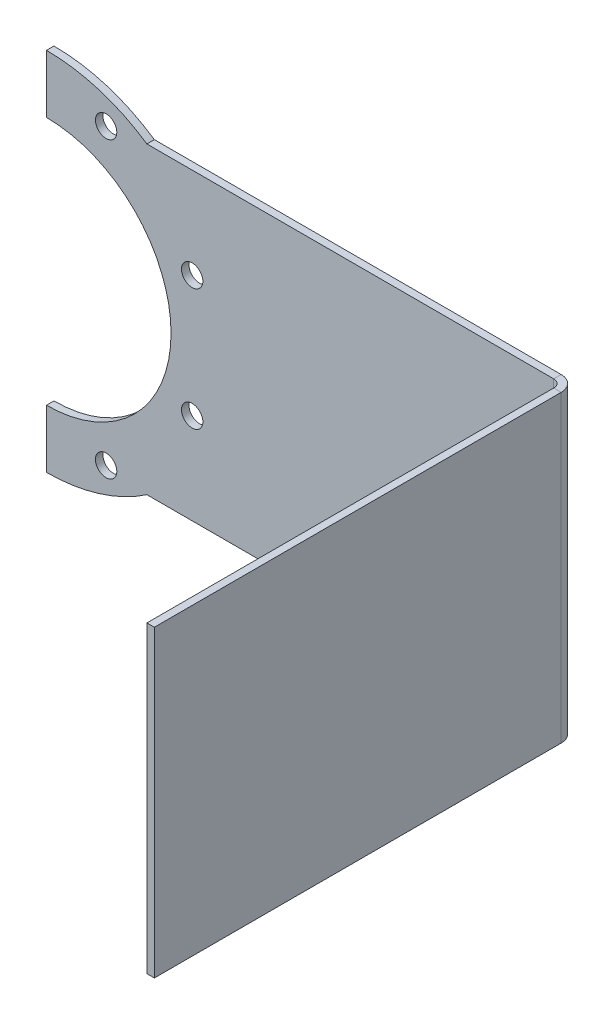
from build123d import *

# Parameters (mm, degrees)
SKETCH1_R              = 2.25
BASE_FLANGE1_DEPTH     = 1.5748
SKETCHED_START         = -31.998080115
SKETCHED_BEND1_DEPTH   = 63.99616023
SKETCHED_BEND1_2_DEPTH = 63.99616023


# Read off the part's stored shape, not the designer's step: Sketched Bend1
# Sheet-metal steps are written as plain solids
with BuildPart() as part:
    # Sketch1 → Base-Flange1 (new body)
    with BuildSketch(Plane.XY):
        with BuildLine():
            Line((0.25, 38.499188303), (0.25, 26.248809497))
            ThreePointArc((0.25, 26.248809497), (26.498809497, 0), (0.25, -26.248809497))
            Line((0.25, -26.248809497), (0.25, -38.499188303))
            ThreePointArc((0.25, -38.499188303), (11.317914827, -36.837266048), (21.409644298, -31.998080115))
            Line((21.409644298, -31.998080115), (102.929679939, -31.998080115))
            Line((102.929679939, -31.998080115), (196.443018387, -31.998080115))
            Line((196.443018387, -31.998080115), (196.443018387, 31.998080115))
            Line((196.443018387, 31.998080115), (102.929679939, 31.998080115))
            Line((102.929679939, 31.998080115), (21.409644298, 31.998080115))
            ThreePointArc((21.409644298, 31.998080115), (11.317914827, 36.837266048), (0.25, 38.499188303))
        make_face()
        with Locations((12.819894984, 30.949964339)):
            Circle(SKETCH1_R, mode=Mode.SUBTRACT)
        with Locations((30.949964339, 12.819894984)):
            Circle(SKETCH1_R, mode=Mode.SUBTRACT)
        with Locations((30.949964339, -12.819894984)):
            Circle(SKETCH1_R, mode=Mode.SUBTRACT)
        with Locations((12.819894984, -30.949964339)):
            Circle(SKETCH1_R, mode=Mode.SUBTRACT)
    extrude(amount=-BASE_FLANGE1_DEPTH)

    # Sketched Bend1 outline → Sketched Bend1 (cut)
    with BuildSketch(Plane(origin=(0, 0, 0), x_dir=(1, 0, 0), z_dir=(0, 1, 0)).offset(SKETCHED_START)):
        with BuildLine():
            ThreePointArc((107.11495185, 1.5748), (108.71495025, 1.153848498), (109.90062672, 0))
            Line((109.90062672, 0), (196.443018387, 0))
            Line((196.443018387, 0), (196.443018387, 1.5748))
            Line((196.443018387, 1.5748), (107.11495185, 1.5748))
        make_face()
    extrude(amount=SKETCHED_BEND1_DEPTH, mode=Mode.SUBTRACT)

    # Sketched Bend1 2 outline → Sketched Bend1 2 (add)
    with BuildSketch(Plane(origin=(0, 0, 0), x_dir=(1, 0, 0), z_dir=(0, 1, 0)).offset(SKETCHED_START)):
        with BuildLine():
            Line((108.79135185, -1.6764), (108.79135185, -87.381707553))
            Line((108.79135185, -87.381707553), (110.36615185, -87.381707553))
            Line((110.36615185, -87.381707553), (110.36615185, -1.6764))
            ThreePointArc((110.36615185, -1.6764), (110.247609474, -0.806481813), (109.90062672, 0))
            Line((109.90062672, 0), (107.11495185, 0))
            ThreePointArc((107.11495185, 0), (108.300345658, -0.491006192), (108.79135185, -1.6764))
        make_face()
    extrude(amount=SKETCHED_BEND1_2_DEPTH)


solid = part.part
